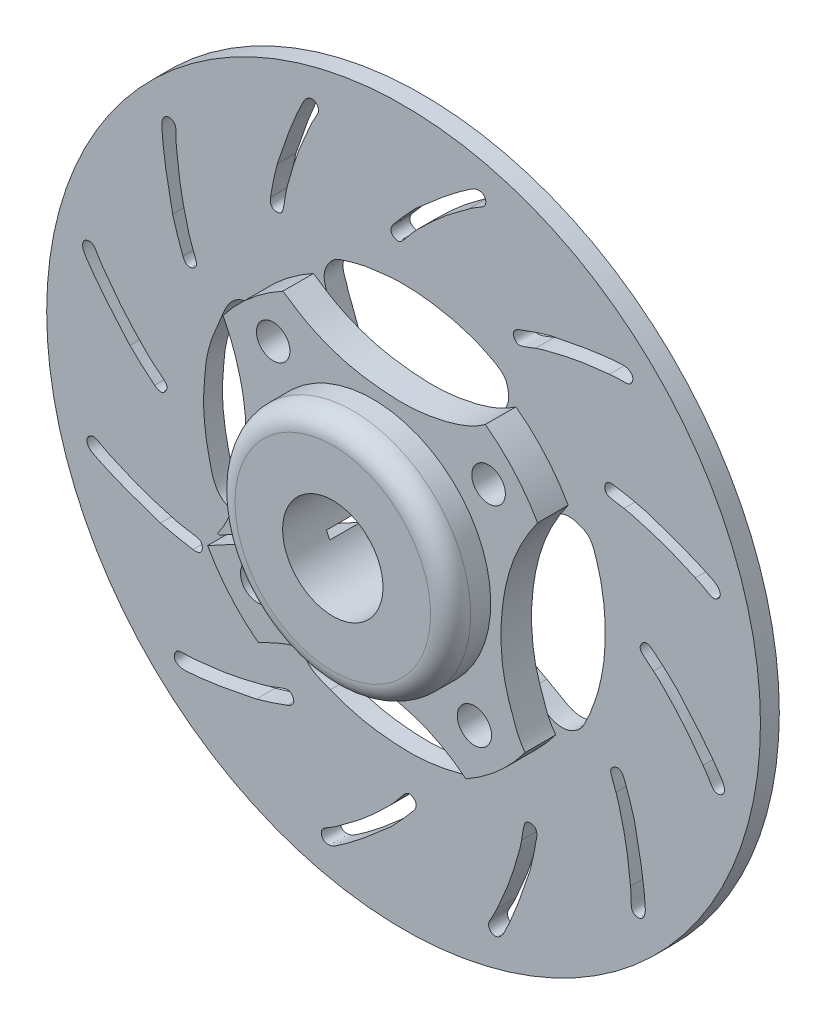
from build123d import *

# Parameters (mm, degrees)
SKETCH1_R             = 88.9
SKETCH1_R_2           = 4.07747742
BOSS_EXTRUDE1_DEPTH   = 4.7
SKETCH2_R             = 4.18367601
SKETCH2_R_2           = 4.175439145
SKETCH2_R_3           = 4.218912194
SKETCH2_R_4           = 4.270344274
BOSS_EXTRUDE2_DEPTH   = 7.62
SKETCH3_R             = 29.35
BOSS_EXTRUDE3_DEPTH   = 10
FILLET1_R             = 5
SKETCH4_R             = 12.5
CUT_EXTRUDE1_DEPTH    = 26
BODY_MOVE_COPY9_ANGLE = 3


with BuildPart() as part:
    # Sketch1 → Boss-Extrude1 (new body)
    with BuildSketch(Plane.XY):
        Circle(SKETCH1_R)
        with Locations((-27.374966014, -24.062451156)):
            Circle(SKETCH1_R_2, mode=Mode.SUBTRACT)
        with Locations((-23.994022432, 28.43754142)):
            Circle(SKETCH1_R_2, mode=Mode.SUBTRACT)
        with Locations((28.505970144, 25.056597838)):
            Circle(SKETCH1_R_2, mode=Mode.SUBTRACT)
        with Locations((25.125026562, -27.443394738)):
            Circle(SKETCH1_R_2, mode=Mode.SUBTRACT)
        with BuildLine():
            add(Edge.make_bspline(
                [(-39.796972275, 26.922044723), (-43.51449301, 25.961041806), (-44.921867219, 21.222131716), (-47.210450222, 16.353689591), (-48.42755617, 12.799512246), (-49.330731017, 9.025790153), (-49.547867266, 4.458947157), (-49.984671254, 0.092855877), (-49.609553632, -4.229262676), (-49.113913448, -8.310445828), (-48.24033715, -12.164679918), (-47.439598583, -15.683903956), (-45.666643473, -18.602778233), (-42.80745232, -19.963202645), (-39.222778152, -19.846001741), (-35.654884057, -18.345655898), (-31.259888958, -16.649549093), (-26.996550931, -15.244238297), (-23.434805875, -13.379026123), (-20.446967539, -13.844570629), (-18.540235541, -15.657785097), (-16.650687923, -17.631197803), (-16.403243332, -20.244855587), (-17.727618064, -22.654996098), (-19.544820805, -25.709175528), (-21.305244064, -29.485905755), (-23.184921482, -32.73263843), (-24.85319827, -35.47153984), (-25.704064387, -38.532729608), (-25.168560148, -41.638766555), (-22.800486373, -44.820200205), (-19.8950043, -45.580827462), (-18.211809321, -46.250491884)],
                knots=[0, 0, 0, 0, 0.086034055, 0.119910947, 0.141356415, 0.183712842, 0.220479367, 0.260324832, 0.297786521, 0.333172123, 0.367414684, 0.400712751, 0.427087621, 0.453178029, 0.478899839, 0.518299636, 0.553136565, 0.601682706, 0.636190375, 0.65438679, 0.676057709, 0.703338417, 0.723663955, 0.739017315, 0.77391887, 0.816795639, 0.847231719, 0.871715557, 0.900233315, 0.928007166, 0.950713121, 1, 1, 1, 1], degree=3))
            add(Edge.make_bspline(
                [(-18.211809321, -46.250491884), (-15.166521025, -47.523075844), (-10.229347315, -48.972216807), (-3.342326696, -49.782278875), (2.061260907, -50.072136286), (7.737154149, -49.615917325), (13.004758266, -48.540454338), (17.329288054, -47.374188933), (19.842696695, -45.445855687), (21.039866084, -43.365599755), (21.493199266, -40.567389743), (20.423007122, -37.83349908), (19.45861076, -34.902866543), (18.14762822, -31.801616538), (17.129292363, -28.607313593), (16.003433633, -25.802064999), (14.939213578, -23.719432358), (14.743311284, -21.291754206), (16.255989207, -18.952313297), (18.263003746, -17.271408565), (20.68643576, -16.30365833), (22.78775311, -17.146615398), (24.688263657, -18.388911752), (27.535060335, -19.84486722), (29.626565694, -21.026295959), (30.974445426, -21.751193564)],
                knots=[0, 0, 0, 0, 0.11787223, 0.182265264, 0.247283311, 0.310808064, 0.384701481, 0.439833927, 0.468325465, 0.495251715, 0.523732965, 0.566276116, 0.597265592, 0.634461316, 0.686170615, 0.716946378, 0.74224478, 0.769577195, 0.799045484, 0.837192377, 0.86349158, 0.886332937, 0.914024889, 0.945422786, 1, 1, 1, 1], degree=3))
            add(Edge.make_bspline(
                [(30.974445426, -21.751193564), (32.003322346, -22.374489021), (33.934722137, -23.332169814), (36.304190872, -24.868561945), (38.493781279, -25.582660313), (40.651674723, -25.61071046), (42.684454755, -24.737671182), (44.336475558, -23.374838722), (45.288106968, -21.560274073), (46.306314995, -19.51151721), (47.282433933, -16.799965604), (48.452928233, -13.585106381), (49.377849207, -9.568991543), (49.970870195, -6.026848976), (50.203591073, -2.376298778), (50.262637511, 0.517619958), (50.17235244, 3.466086556), (49.977695835, 5.836180957), (49.563199559, 8.633723766), (49.012593166, 11.765977263), (48.058919569, 14.912858134), (47.225800856, 17.519289802), (45.876010276, 19.520434025), (44.368387326, 20.003608014), (43.540911194, 20.363194028), (43.170642612, 20.469865616), (42.683521538, 20.645792677), (42.237368456, 20.72883244), (41.588584465, 20.783006234), (40.607897889, 20.851741113), (39.485156628, 20.494729116), (37.975205491, 19.946335778), (34.96346939, 18.779417356), (32.30237294, 17.877509803), (30.343888009, 17.164066957)],
                knots=[0, 0, 0, 0, 0.047660097, 0.085570693, 0.111479653, 0.13806014, 0.169229235, 0.197306097, 0.221160681, 0.249655524, 0.288252435, 0.33527207, 0.385315565, 0.451498919, 0.477486394, 0.530381896, 0.56627772, 0.594482099, 0.624670246, 0.678458715, 0.720529439, 0.754689328, 0.787884057, 0.810482048, 0.815240602, 0.82390699, 0.827813968, 0.833221312, 0.842621175, 0.853312213, 0.87205883, 0.888423793, 0.917333374, 1, 1, 1, 1], degree=3))
            add(Edge.make_bspline(
                [(30.343888009, 17.164066957), (29.309153231, 16.769671968), (27.823788742, 16.031805009), (25.692033419, 15.351599736), (24.026422046, 14.576924915), (22.056536511, 14.680432714), (20.347787272, 15.758849313), (19.25671454, 17.289264458), (17.800238421, 18.40619954), (17.546423648, 19.996255141), (17.382935291, 21.496194833), (18.19632835, 22.992919838), (19.48743127, 25.199625743), (21.081573968, 28.319857376), (23.1358263, 31.941108367), (24.631619477, 34.786294903), (25.639757271, 36.667447605), (26.070458694, 37.856679179), (26.23407121, 38.967242597), (26.076816537, 40.296517815), (25.851000604, 41.674502908), (25.097495446, 43.038039825), (24.381833125, 43.653138353), (23.995841352, 43.931022196)],
                knots=[0, 0, 0, 0, 0.078169858, 0.116383522, 0.157902413, 0.206456957, 0.247952262, 0.295693498, 0.339561834, 0.369996849, 0.405552268, 0.443740642, 0.485880857, 0.587567207, 0.689814094, 0.779788252, 0.814358994, 0.840151294, 0.868713812, 0.892473634, 0.934347025, 0.966355314, 1, 1, 1, 1], degree=3))
            add(Edge.make_bspline(
                [(23.995841352, 43.931022196), (23.659598549, 44.22140694), (22.94750498, 44.694684198), (21.95653751, 45.153189095), (21.072047035, 45.655193214), (20.086146911, 46.087666907), (18.562842117, 46.836899702), (17.329899632, 47.337613246), (16.500112708, 47.585529311)],
                knots=[0, 0, 0, 0, 0.15927464, 0.304479599, 0.39124603, 0.523648309, 0.690107311, 1, 1, 1, 1], degree=3))
            add(Edge.make_bspline(
                [(16.500112708, 47.585529311), (15.62871215, 47.82182276), (14.144310198, 48.312562047), (12.00593847, 48.914921007), (10.124650846, 49.22827568), (7.216668416, 49.833129199), (2.875733188, 50.316651449), (-2.068807492, 50.428004213), (-6.562993204, 49.813803523), (-10.405562033, 49.396042331), (-13.830701738, 48.3296996), (-16.662729213, 47.574325783), (-18.170444851, 46.204887964), (-19.040736095, 44.917914669), (-19.698551589, 43.496488316), (-19.838012478, 41.980280907), (-19.596021289, 40.420342012), (-19.04388369, 39.229690859), (-18.738482473, 38.181442938), (-18.51906425, 37.181736497), (-17.98677624, 35.992926871), (-17.377491853, 34.476256259), (-16.703228307, 32.453551802), (-15.762528666, 30.252671875), (-14.950427911, 27.937138544), (-14.34281483, 26.228871699), (-13.788324327, 24.999593485), (-13.433839666, 23.709261101), (-13.509100351, 21.984502518), (-14.601602107, 20.476008479), (-16.000159559, 19.379670129), (-17.276283985, 18.267341087), (-18.922392447, 17.60789758), (-20.627709795, 17.733190246), (-21.879139023, 18.533749656), (-23.070839635, 18.996403453), (-23.964005569, 19.640759431), (-25.061086064, 20.110092987), (-26.118522029, 20.783972816), (-27.600092577, 21.542501478), (-29.823023598, 22.759273556), (-32.11643212, 24.093283711), (-34.185756925, 25.292491799), (-35.454366164, 26.062464637), (-36.58038147, 26.400412602), (-38.001595931, 26.792882768), (-39.025127264, 27.018228963), (-39.796972275, 26.922044723)],
                knots=[0, 0, 0, 0, 0.02963422, 0.051354753, 0.07284978, 0.09221066, 0.148871737, 0.216074291, 0.253828779, 0.297826147, 0.342407935, 0.372050129, 0.39221048, 0.407591461, 0.423002468, 0.443122136, 0.45651194, 0.474439519, 0.485893825, 0.492331806, 0.507994362, 0.52843352, 0.546065225, 0.577953483, 0.606967471, 0.626633827, 0.63746718, 0.651191656, 0.670392634, 0.691793228, 0.709703481, 0.729000297, 0.747008178, 0.766568579, 0.782311539, 0.795237618, 0.808382798, 0.818183391, 0.834297561, 0.849454636, 0.872826412, 0.917516751, 0.936517589, 0.951474041, 0.966000407, 0.974861338, 1, 1, 1, 1], degree=3))
        make_face(mode=Mode.SUBTRACT)
        with BuildLine():
            add(Edge.make_bspline(
                [(-31.472558231, 60.540603915), (-29.764581382, 65.34489088), (-28.513412004, 69.651124006), (-25.720195066, 75.626600274), (-25.007339846, 77.20002944), (-24.186931765, 78.430801548), (-22.745075318, 79.116705574), (-21.526689329, 78.435047494), (-20.980866309, 77.196730149), (-21.970728074, 75.223848717), (-22.82200754, 73.889425632), (-23.312380942, 72.67385443)],
                knots=[0, 0, 0, 0, 0.504601115, 0.560680655, 0.631374965, 0.687572346, 0.734694365, 0.781164138, 0.819557005, 0.866509133, 1, 1, 1, 1], degree=3))
            add(Edge.make_bspline(
                [(-23.312380942, 72.67385443), (-23.656709462, 71.683995658), (-24.439890031, 70.241305942), (-25.336678529, 67.848036288), (-26.245677579, 65.927605792), (-26.783341534, 63.821859344), (-27.479255907, 62.240447779), (-27.999798512, 60.49633404), (-28.595297781, 58.10072981), (-29.231668661, 56.208056413), (-29.410721478, 54.925352246)],
                knots=[0, 0, 0, 0, 0.166737046, 0.260765648, 0.407477512, 0.504417848, 0.606220534, 0.68233795, 0.794384205, 1, 1, 1, 1], degree=3))
            add(Edge.make_bspline(
                [(-29.410721478, 54.925352246), (-29.586422582, 54.020509087), (-29.69256378, 52.813701689), (-30.030392713, 51.338764458), (-30.384212935, 50.295087668), (-31.654508753, 50.027037686), (-33.222959963, 50.481263538), (-33.242485552, 51.890552827), (-33.151947829, 52.476040032)],
                knots=[0, 0, 0, 0, 0.309574359, 0.393483277, 0.512236199, 0.643022767, 0.780582146, 1, 1, 1, 1], degree=3))
            add(Edge.make_bspline(
                [(-31.472558231, 60.540603915), (-31.855191575, 59.138802545), (-32.445651368, 56.455204136), (-32.942095765, 53.753351228), (-33.151947829, 52.476040032)],
                knots=[0, 0, 0, 0, 0.528781881, 1, 1, 1, 1], degree=3))
        make_face(mode=Mode.SUBTRACT)
        with BuildLine():
            add(Edge.make_bspline(
                [(16.147813097, 74.593594598), (15.354686465, 73.908516015), (13.955087339, 73.050700356), (11.98181089, 71.426462287), (10.234379373, 70.217820216), (8.715875505, 68.663022276), (7.322490197, 67.641436873), (5.999630208, 66.391261371), (4.286110598, 64.614356884), (2.788660551, 63.293439082), (1.992244179, 62.272111096)],
                knots=[0, 0, 0, 0, 0.166737046, 0.260765648, 0.407477512, 0.504417848, 0.606220534, 0.68233795, 0.794384205, 1, 1, 1, 1], degree=3))
            add(Edge.make_bspline(
                [(1.992244179, 62.272111096), (1.38766098, 61.576344486), (0.692336307, 60.584289221), (-0.337700746, 59.475870577), (-1.165956442, 58.748930074), (-2.400089881, 59.151939889), (-3.531295548, 60.32953662), (-2.843560559, 61.559779741), (-2.472408989, 62.021557672)],
                knots=[0, 0, 0, 0, 0.309574359, 0.393483277, 0.512236199, 0.643022767, 0.780582146, 1, 1, 1, 1], degree=3))
            add(Edge.make_bspline(
                [(3.014267007, 68.165980066), (1.981996126, 67.14330114), (0.128843741, 65.114466641), (-1.652016173, 63.022815584), (-2.472408989, 62.021557672)],
                knots=[0, 0, 0, 0, 0.528781881, 1, 1, 1, 1], degree=3))
            add(Edge.make_bspline(
                [(3.014267007, 68.165980066), (6.895561831, 71.472626201), (10.132222859, 74.576348793), (15.53895782, 78.354654572), (16.943023133, 79.360856591), (18.268903426, 80.016532463), (19.860539751, 79.88961455), (20.574863929, 78.690088342), (20.428401857, 77.344762553), (18.584715707, 76.131127996), (17.180274521, 75.401123439), (16.147813097, 74.593594598)],
                knots=[0, 0, 0, 0, 0.504601115, 0.560680655, 0.631374965, 0.687572346, 0.734694365, 0.781164138, 0.819557005, 0.866509133, 1, 1, 1, 1], degree=3))
        make_face(mode=Mode.SUBTRACT)
        with BuildLine():
            add(Edge.make_bspline(
                [(51.281213657, 56.526041333), (50.251806554, 56.329309193), (48.610810326, 56.286218603), (46.089783757, 55.866225398), (43.972142637, 55.693226419), (41.879680742, 55.105983839), (40.162180966, 54.917957582), (38.391462859, 54.496703832), (36.019059103, 53.814619212), (34.061770421, 53.419395862), (32.861389618, 52.933108067)],
                knots=[0, 0, 0, 0, 0.166737046, 0.260765648, 0.407477512, 0.504417848, 0.606220534, 0.68233795, 0.794384205, 1, 1, 1, 1], degree=3))
            add(Edge.make_bspline(
                [(32.861389618, 52.933108067), (31.989921904, 52.632848107), (30.891725441, 52.121365382), (29.445477863, 51.676465205), (28.364717139, 51.46104411), (27.497431136, 52.427127567), (27.106576658, 54.012559086), (28.317294189, 54.734113386), (28.869609843, 54.948449021)],
                knots=[0, 0, 0, 0, 0.309574359, 0.393483277, 0.512236199, 0.643022767, 0.780582146, 1, 1, 1, 1], degree=3))
            add(Edge.make_bspline(
                [(36.693421835, 57.526336908), (35.288109566, 57.156806418), (32.668815273, 56.326360395), (30.080719819, 55.405367401), (28.869609843, 54.948449021)],
                knots=[0, 0, 0, 0, 0.528781881, 1, 1, 1, 1], degree=3))
            add(Edge.make_bspline(
                [(36.693421835, 57.526336908), (41.708044819, 58.44932905), (46.062936789, 59.518901147), (52.634459506, 60.087642454), (54.353516745, 60.257006307), (55.829600697, 60.161898123), (57.144539232, 59.256165823), (57.163399013, 57.860183565), (56.363896244, 56.768328292), (54.160399922, 56.63913301), (52.579115899, 56.709151111), (51.281213657, 56.526041333)],
                knots=[0, 0, 0, 0, 0.504601115, 0.560680655, 0.631374965, 0.687572346, 0.734694365, 0.781164138, 0.819557005, 0.866509133, 1, 1, 1, 1], degree=3))
        make_face(mode=Mode.SUBTRACT)
        with BuildLine():
            add(Edge.make_bspline(
                [(72.67385443, 23.312380942), (71.683995658, 23.656709462), (70.241305942, 24.439890031), (67.848036288, 25.336678529), (65.927605792, 26.245677579), (63.821859344, 26.783341534), (62.240447779, 27.479255907), (60.49633404, 27.999798512), (58.10072981, 28.595297781), (56.208056413, 29.231668661), (54.925352246, 29.410721478)],
                knots=[0, 0, 0, 0, 0.166737046, 0.260765648, 0.407477512, 0.504417848, 0.606220534, 0.68233795, 0.794384205, 1, 1, 1, 1], degree=3))
            add(Edge.make_bspline(
                [(54.925352246, 29.410721478), (54.020509087, 29.586422582), (52.813701689, 29.69256378), (51.338764458, 30.030392713), (50.295087668, 30.384212935), (50.027037686, 31.654508753), (50.481263538, 33.222959963), (51.890552827, 33.242485552), (52.476040032, 33.151947829)],
                knots=[0, 0, 0, 0, 0.309574359, 0.393483277, 0.512236199, 0.643022767, 0.780582146, 1, 1, 1, 1], degree=3))
            add(Edge.make_bspline(
                [(60.540603915, 31.472558231), (59.138802545, 31.855191575), (56.455204136, 32.445651368), (53.753351228, 32.942095765), (52.476040032, 33.151947829)],
                knots=[0, 0, 0, 0, 0.528781881, 1, 1, 1, 1], degree=3))
            add(Edge.make_bspline(
                [(60.540603915, 31.472558231), (65.34489088, 29.764581382), (69.651124006, 28.513412004), (75.626600274, 25.720195066), (77.20002944, 25.007339846), (78.430801548, 24.186931765), (79.116705574, 22.745075318), (78.435047494, 21.526689329), (77.196730149, 20.980866309), (75.223848717, 21.970728074), (73.889425632, 22.82200754), (72.67385443, 23.312380942)],
                knots=[0, 0, 0, 0, 0.504601115, 0.560680655, 0.631374965, 0.687572346, 0.734694365, 0.781164138, 0.819557005, 0.866509133, 1, 1, 1, 1], degree=3))
        make_face(mode=Mode.SUBTRACT)
        with BuildLine():
            add(Edge.make_bspline(
                [(74.593594598, -16.147813097), (73.908516015, -15.354686465), (73.050700356, -13.955087339), (71.426462287, -11.98181089), (70.217820216, -10.234379373), (68.663022276, -8.715875505), (67.641436873, -7.322490197), (66.391261371, -5.999630208), (64.614356884, -4.286110598), (63.293439082, -2.788660551), (62.272111096, -1.992244179)],
                knots=[0, 0, 0, 0, 0.166737046, 0.260765648, 0.407477512, 0.504417848, 0.606220534, 0.68233795, 0.794384205, 1, 1, 1, 1], degree=3))
            add(Edge.make_bspline(
                [(62.272111096, -1.992244179), (61.576344486, -1.38766098), (60.584289221, -0.692336307), (59.475870577, 0.337700746), (58.748930074, 1.165956442), (59.151939889, 2.400089881), (60.32953662, 3.531295548), (61.559779741, 2.843560559), (62.021557672, 2.472408989)],
                knots=[0, 0, 0, 0, 0.309574359, 0.393483277, 0.512236199, 0.643022767, 0.780582146, 1, 1, 1, 1], degree=3))
            add(Edge.make_bspline(
                [(68.165980066, -3.014267007), (67.14330114, -1.981996126), (65.114466641, -0.128843741), (63.022815584, 1.652016173), (62.021557672, 2.472408989)],
                knots=[0, 0, 0, 0, 0.528781881, 1, 1, 1, 1], degree=3))
            add(Edge.make_bspline(
                [(68.165980066, -3.014267007), (71.472626201, -6.895561831), (74.576348793, -10.132222859), (78.354654572, -15.53895782), (79.360856591, -16.943023133), (80.016532463, -18.268903426), (79.88961455, -19.860539751), (78.690088342, -20.574863929), (77.344762553, -20.428401857), (76.131127996, -18.584715707), (75.401123439, -17.180274521), (74.593594598, -16.147813097)],
                knots=[0, 0, 0, 0, 0.504601115, 0.560680655, 0.631374965, 0.687572346, 0.734694365, 0.781164138, 0.819557005, 0.866509133, 1, 1, 1, 1], degree=3))
        make_face(mode=Mode.SUBTRACT)
        with BuildLine():
            add(Edge.make_bspline(
                [(56.526041333, -51.281213657), (56.329309193, -50.251806554), (56.286218603, -48.610810326), (55.866225398, -46.089783757), (55.693226419, -43.972142637), (55.105983839, -41.879680742), (54.917957582, -40.162180966), (54.496703832, -38.391462859), (53.814619212, -36.019059103), (53.419395862, -34.061770421), (52.933108067, -32.861389618)],
                knots=[0, 0, 0, 0, 0.166737046, 0.260765648, 0.407477512, 0.504417848, 0.606220534, 0.68233795, 0.794384205, 1, 1, 1, 1], degree=3))
            add(Edge.make_bspline(
                [(52.933108067, -32.861389618), (52.632848107, -31.989921904), (52.121365382, -30.891725441), (51.676465205, -29.445477863), (51.46104411, -28.364717139), (52.427127567, -27.497431136), (54.012559086, -27.106576658), (54.734113386, -28.317294189), (54.948449021, -28.869609843)],
                knots=[0, 0, 0, 0, 0.309574359, 0.393483277, 0.512236199, 0.643022767, 0.780582146, 1, 1, 1, 1], degree=3))
            add(Edge.make_bspline(
                [(57.526336908, -36.693421835), (57.156806418, -35.288109566), (56.326360395, -32.668815273), (55.405367401, -30.080719819), (54.948449021, -28.869609843)],
                knots=[0, 0, 0, 0, 0.528781881, 1, 1, 1, 1], degree=3))
            add(Edge.make_bspline(
                [(57.526336908, -36.693421835), (58.44932905, -41.708044819), (59.518901147, -46.062936789), (60.087642454, -52.634459506), (60.257006307, -54.353516745), (60.161898123, -55.829600697), (59.256165823, -57.144539232), (57.860183565, -57.163399013), (56.768328292, -56.363896244), (56.63913301, -54.160399922), (56.709151111, -52.579115899), (56.526041333, -51.281213657)],
                knots=[0, 0, 0, 0, 0.504601115, 0.560680655, 0.631374965, 0.687572346, 0.734694365, 0.781164138, 0.819557005, 0.866509133, 1, 1, 1, 1], degree=3))
        make_face(mode=Mode.SUBTRACT)
        with BuildLine():
            add(Edge.make_bspline(
                [(23.312380942, -72.67385443), (23.656709462, -71.683995658), (24.439890031, -70.241305942), (25.336678529, -67.848036288), (26.245677579, -65.927605792), (26.783341534, -63.821859344), (27.479255907, -62.240447779), (27.999798512, -60.49633404), (28.595297781, -58.10072981), (29.231668661, -56.208056413), (29.410721478, -54.925352246)],
                knots=[0, 0, 0, 0, 0.166737046, 0.260765648, 0.407477512, 0.504417848, 0.606220534, 0.68233795, 0.794384205, 1, 1, 1, 1], degree=3))
            add(Edge.make_bspline(
                [(29.410721478, -54.925352246), (29.586422582, -54.020509087), (29.69256378, -52.813701689), (30.030392713, -51.338764458), (30.384212935, -50.295087668), (31.654508753, -50.027037686), (33.222959963, -50.481263538), (33.242485552, -51.890552827), (33.151947829, -52.476040032)],
                knots=[0, 0, 0, 0, 0.309574359, 0.393483277, 0.512236199, 0.643022767, 0.780582146, 1, 1, 1, 1], degree=3))
            add(Edge.make_bspline(
                [(31.472558231, -60.540603915), (31.855191575, -59.138802545), (32.445651368, -56.455204136), (32.942095765, -53.753351228), (33.151947829, -52.476040032)],
                knots=[0, 0, 0, 0, 0.528781881, 1, 1, 1, 1], degree=3))
            add(Edge.make_bspline(
                [(31.472558231, -60.540603915), (29.764581382, -65.34489088), (28.513412004, -69.651124006), (25.720195066, -75.626600274), (25.007339846, -77.20002944), (24.186931765, -78.430801548), (22.745075318, -79.116705574), (21.526689329, -78.435047494), (20.980866309, -77.196730149), (21.970728074, -75.223848717), (22.82200754, -73.889425632), (23.312380942, -72.67385443)],
                knots=[0, 0, 0, 0, 0.504601115, 0.560680655, 0.631374965, 0.687572346, 0.734694365, 0.781164138, 0.819557005, 0.866509133, 1, 1, 1, 1], degree=3))
        make_face(mode=Mode.SUBTRACT)
        with BuildLine():
            add(Edge.make_bspline(
                [(-16.147813097, -74.593594598), (-15.354686465, -73.908516015), (-13.955087339, -73.050700356), (-11.98181089, -71.426462287), (-10.234379373, -70.217820216), (-8.715875505, -68.663022276), (-7.322490197, -67.641436873), (-5.999630208, -66.391261371), (-4.286110598, -64.614356884), (-2.788660551, -63.293439082), (-1.992244179, -62.272111096)],
                knots=[0, 0, 0, 0, 0.166737046, 0.260765648, 0.407477512, 0.504417848, 0.606220534, 0.68233795, 0.794384205, 1, 1, 1, 1], degree=3))
            add(Edge.make_bspline(
                [(-1.992244179, -62.272111096), (-1.38766098, -61.576344486), (-0.692336307, -60.584289221), (0.337700746, -59.475870577), (1.165956442, -58.748930074), (2.400089881, -59.151939889), (3.531295548, -60.32953662), (2.843560559, -61.559779741), (2.472408989, -62.021557672)],
                knots=[0, 0, 0, 0, 0.309574359, 0.393483277, 0.512236199, 0.643022767, 0.780582146, 1, 1, 1, 1], degree=3))
            add(Edge.make_bspline(
                [(-3.014267007, -68.165980066), (-1.981996126, -67.14330114), (-0.128843741, -65.114466641), (1.652016173, -63.022815584), (2.472408989, -62.021557672)],
                knots=[0, 0, 0, 0, 0.528781881, 1, 1, 1, 1], degree=3))
            add(Edge.make_bspline(
                [(-3.014267007, -68.165980066), (-6.895561831, -71.472626201), (-10.132222859, -74.576348793), (-15.53895782, -78.354654572), (-16.943023133, -79.360856591), (-18.268903426, -80.016532463), (-19.860539751, -79.88961455), (-20.574863929, -78.690088342), (-20.428401857, -77.344762553), (-18.584715707, -76.131127996), (-17.180274521, -75.401123439), (-16.147813097, -74.593594598)],
                knots=[0, 0, 0, 0, 0.504601115, 0.560680655, 0.631374965, 0.687572346, 0.734694365, 0.781164138, 0.819557005, 0.866509133, 1, 1, 1, 1], degree=3))
        make_face(mode=Mode.SUBTRACT)
        with BuildLine():
            add(Edge.make_bspline(
                [(-51.281213657, -56.526041333), (-50.251806554, -56.329309193), (-48.610810326, -56.286218603), (-46.089783757, -55.866225398), (-43.972142637, -55.693226419), (-41.879680742, -55.105983839), (-40.162180966, -54.917957582), (-38.391462859, -54.496703832), (-36.019059103, -53.814619212), (-34.061770421, -53.419395862), (-32.861389618, -52.933108067)],
                knots=[0, 0, 0, 0, 0.166737046, 0.260765648, 0.407477512, 0.504417848, 0.606220534, 0.68233795, 0.794384205, 1, 1, 1, 1], degree=3))
            add(Edge.make_bspline(
                [(-32.861389618, -52.933108067), (-31.989921904, -52.632848107), (-30.891725441, -52.121365382), (-29.445477863, -51.676465205), (-28.364717139, -51.46104411), (-27.497431136, -52.427127567), (-27.106576658, -54.012559086), (-28.317294189, -54.734113386), (-28.869609843, -54.948449021)],
                knots=[0, 0, 0, 0, 0.309574359, 0.393483277, 0.512236199, 0.643022767, 0.780582146, 1, 1, 1, 1], degree=3))
            add(Edge.make_bspline(
                [(-36.693421835, -57.526336908), (-35.288109566, -57.156806418), (-32.668815273, -56.326360395), (-30.080719819, -55.405367401), (-28.869609843, -54.948449021)],
                knots=[0, 0, 0, 0, 0.528781881, 1, 1, 1, 1], degree=3))
            add(Edge.make_bspline(
                [(-36.693421835, -57.526336908), (-41.708044819, -58.44932905), (-46.062936789, -59.518901147), (-52.634459506, -60.087642454), (-54.353516745, -60.257006307), (-55.829600697, -60.161898123), (-57.144539232, -59.256165823), (-57.163399013, -57.860183565), (-56.363896244, -56.768328292), (-54.160399922, -56.63913301), (-52.579115899, -56.709151111), (-51.281213657, -56.526041333)],
                knots=[0, 0, 0, 0, 0.504601115, 0.560680655, 0.631374965, 0.687572346, 0.734694365, 0.781164138, 0.819557005, 0.866509133, 1, 1, 1, 1], degree=3))
        make_face(mode=Mode.SUBTRACT)
        with BuildLine():
            add(Edge.make_bspline(
                [(-72.67385443, -23.312380942), (-71.683995658, -23.656709462), (-70.241305942, -24.439890031), (-67.848036288, -25.336678529), (-65.927605792, -26.245677579), (-63.821859344, -26.783341534), (-62.240447779, -27.479255907), (-60.49633404, -27.999798512), (-58.10072981, -28.595297781), (-56.208056413, -29.231668661), (-54.925352246, -29.410721478)],
                knots=[0, 0, 0, 0, 0.166737046, 0.260765648, 0.407477512, 0.504417848, 0.606220534, 0.68233795, 0.794384205, 1, 1, 1, 1], degree=3))
            add(Edge.make_bspline(
                [(-54.925352246, -29.410721478), (-54.020509087, -29.586422582), (-52.813701689, -29.69256378), (-51.338764458, -30.030392713), (-50.295087668, -30.384212935), (-50.027037686, -31.654508753), (-50.481263538, -33.222959963), (-51.890552827, -33.242485552), (-52.476040032, -33.151947829)],
                knots=[0, 0, 0, 0, 0.309574359, 0.393483277, 0.512236199, 0.643022767, 0.780582146, 1, 1, 1, 1], degree=3))
            add(Edge.make_bspline(
                [(-60.540603915, -31.472558231), (-59.138802545, -31.855191575), (-56.455204136, -32.445651368), (-53.753351228, -32.942095765), (-52.476040032, -33.151947829)],
                knots=[0, 0, 0, 0, 0.528781881, 1, 1, 1, 1], degree=3))
            add(Edge.make_bspline(
                [(-60.540603915, -31.472558231), (-65.34489088, -29.764581382), (-69.651124006, -28.513412004), (-75.626600274, -25.720195066), (-77.20002944, -25.007339846), (-78.430801548, -24.186931765), (-79.116705574, -22.745075318), (-78.435047494, -21.526689329), (-77.196730149, -20.980866309), (-75.223848717, -21.970728074), (-73.889425632, -22.82200754), (-72.67385443, -23.312380942)],
                knots=[0, 0, 0, 0, 0.504601115, 0.560680655, 0.631374965, 0.687572346, 0.734694365, 0.781164138, 0.819557005, 0.866509133, 1, 1, 1, 1], degree=3))
        make_face(mode=Mode.SUBTRACT)
        with BuildLine():
            add(Edge.make_bspline(
                [(-74.593594598, 16.147813097), (-73.908516015, 15.354686465), (-73.050700356, 13.955087339), (-71.426462287, 11.98181089), (-70.217820216, 10.234379373), (-68.663022276, 8.715875505), (-67.641436873, 7.322490197), (-66.391261371, 5.999630208), (-64.614356884, 4.286110598), (-63.293439082, 2.788660551), (-62.272111096, 1.992244179)],
                knots=[0, 0, 0, 0, 0.166737046, 0.260765648, 0.407477512, 0.504417848, 0.606220534, 0.68233795, 0.794384205, 1, 1, 1, 1], degree=3))
            add(Edge.make_bspline(
                [(-62.272111096, 1.992244179), (-61.576344486, 1.38766098), (-60.584289221, 0.692336307), (-59.475870577, -0.337700746), (-58.748930074, -1.165956442), (-59.151939889, -2.400089881), (-60.32953662, -3.531295548), (-61.559779741, -2.843560559), (-62.021557672, -2.472408989)],
                knots=[0, 0, 0, 0, 0.309574359, 0.393483277, 0.512236199, 0.643022767, 0.780582146, 1, 1, 1, 1], degree=3))
            add(Edge.make_bspline(
                [(-68.165980066, 3.014267007), (-67.14330114, 1.981996126), (-65.114466641, 0.128843741), (-63.022815584, -1.652016173), (-62.021557672, -2.472408989)],
                knots=[0, 0, 0, 0, 0.528781881, 1, 1, 1, 1], degree=3))
            add(Edge.make_bspline(
                [(-68.165980066, 3.014267007), (-71.472626201, 6.895561831), (-74.576348793, 10.132222859), (-78.354654572, 15.53895782), (-79.360856591, 16.943023133), (-80.016532463, 18.268903426), (-79.88961455, 19.860539751), (-78.690088342, 20.574863929), (-77.344762553, 20.428401857), (-76.131127996, 18.584715707), (-75.401123439, 17.180274521), (-74.593594598, 16.147813097)],
                knots=[0, 0, 0, 0, 0.504601115, 0.560680655, 0.631374965, 0.687572346, 0.734694365, 0.781164138, 0.819557005, 0.866509133, 1, 1, 1, 1], degree=3))
        make_face(mode=Mode.SUBTRACT)
        with BuildLine():
            add(Edge.make_bspline(
                [(-56.526041333, 51.281213657), (-56.329309193, 50.251806554), (-56.286218603, 48.610810326), (-55.866225398, 46.089783757), (-55.693226419, 43.972142637), (-55.105983839, 41.879680742), (-54.917957582, 40.162180966), (-54.496703832, 38.391462859), (-53.814619212, 36.019059103), (-53.419395862, 34.061770421), (-52.933108067, 32.861389618)],
                knots=[0, 0, 0, 0, 0.166737046, 0.260765648, 0.407477512, 0.504417848, 0.606220534, 0.68233795, 0.794384205, 1, 1, 1, 1], degree=3))
            add(Edge.make_bspline(
                [(-52.933108067, 32.861389618), (-52.632848107, 31.989921904), (-52.121365382, 30.891725441), (-51.676465205, 29.445477863), (-51.46104411, 28.364717139), (-52.427127567, 27.497431136), (-54.012559086, 27.106576658), (-54.734113386, 28.317294189), (-54.948449021, 28.869609843)],
                knots=[0, 0, 0, 0, 0.309574359, 0.393483277, 0.512236199, 0.643022767, 0.780582146, 1, 1, 1, 1], degree=3))
            add(Edge.make_bspline(
                [(-57.526336908, 36.693421835), (-57.156806418, 35.288109566), (-56.326360395, 32.668815273), (-55.405367401, 30.080719819), (-54.948449021, 28.869609843)],
                knots=[0, 0, 0, 0, 0.528781881, 1, 1, 1, 1], degree=3))
            add(Edge.make_bspline(
                [(-57.526336908, 36.693421835), (-58.44932905, 41.708044819), (-59.518901147, 46.062936789), (-60.087642454, 52.634459506), (-60.257006307, 54.353516745), (-60.161898123, 55.829600697), (-59.256165823, 57.144539232), (-57.860183565, 57.163399013), (-56.768328292, 56.363896244), (-56.63913301, 54.160399922), (-56.709151111, 52.579115899), (-56.526041333, 51.281213657)],
                knots=[0, 0, 0, 0, 0.504601115, 0.560680655, 0.631374965, 0.687572346, 0.734694365, 0.781164138, 0.819557005, 0.866509133, 1, 1, 1, 1], degree=3))
        make_face(mode=Mode.SUBTRACT)
    extrude(amount=BOSS_EXTRUDE1_DEPTH)


with BuildPart() as body_2:
    # Sketch2 → Boss-Extrude2 (new body)
    with BuildSketch(Plane.XY):
        with BuildLine():
            Line((-37.634628687, -20.912344774), (-37.291812926, -21.144121861))
            Line((-37.291812926, -21.144121861), (-11.223016332, -5.265934491))
            Line((-11.223016332, -5.265934491), (-10.23664952, -6.885350813))
            Line((-10.23664952, -6.885350813), (-39.934023895, -24.973660835))
            ThreePointArc((-39.934023895, -24.973660835), (-33.984841042, -32.610436663), (-26.600023864, -38.869637642))
            add(Edge.make_bspline(
                [(-26.600023864, -38.869637642), (-24.761438401, -37.97211903), (-21.903510209, -36.208164043), (-17.21787538, -34.378439177), (-13.589667595, -33.09070669), (-10.585363184, -32.673119773), (-8.180711141, -32.04475275), (-5.609039967, -31.712900838), (6.251058427, -31.326360641), (17.100214733, -33.654973829), (25.269988061, -39.747172269)],
                knots=[0, 0, 0, 0, 0.112337385, 0.183127321, 0.275731791, 0.322385942, 0.349032382, 0.411967602, 0.463999396, 1, 1, 1, 1], degree=3))
            ThreePointArc((25.269988061, -39.747172269), (33.029651651, -33.57755369), (39.326086643, -25.920434204))
            add(Edge.make_bspline(
                [(39.326086643, -25.920434204), (37.492152301, -23.839115667), (35.887941168, -19.759926366), (33.313069016, -13.188082951), (31.873499446, -4.862277637), (32.039688537, 4.750971469), (34.398988348, 15.519723977), (37.503789987, 21.776801269), (39.749145928, 25.266883425)],
                knots=[0, 0, 0, 0, 0.152149228, 0.240137859, 0.391778365, 0.616919879, 0.769442046, 1, 1, 1, 1], degree=3))
            ThreePointArc((39.749145928, 25.266883425), (33.607458625, 32.999223093), (25.988567778, 39.281093987))
            add(Edge.make_bspline(
                [(-24.562828341, 40.188026375), (-22.966170353, 39.317401288), (-20.164475182, 37.493432085), (-15.784957454, 35.562085879), (-11.578567665, 34.185840708), (-6.356884184, 32.968294073), (-0.437103173, 32.496867952), (6.292737014, 32.381156794), (12.255712087, 33.297732955), (19.111443694, 35.2071507), (23.562649974, 37.284104005), (25.988567778, 39.281093987)],
                knots=[0, 0, 0, 0, 0.102146543, 0.187239333, 0.267910646, 0.350500983, 0.487691025, 0.600458122, 0.72789444, 0.824624761, 1, 1, 1, 1], degree=3))
            ThreePointArc((-24.562828341, 40.188026375), (-32.390112868, 34.194891262), (-38.798452115, 26.70374718))
            add(Edge.make_bspline(
                [(-38.798452115, 26.70374718), (-37.95067403, 25.277134515), (-36.64278513, 22.908870562), (-35.149197952, 19.312999787), (-33.931300109, 15.746504912), (-32.93267278, 12.218235445), (-32.313647677, 8.693313011), (-31.716772402, 4.098576738), (-31.634912302, -1.098550362), (-32.507160219, -6.520393309), (-33.94323864, -12.894759656), (-35.577505346, -17.869704486), (-37.634628687, -20.912344774)],
                knots=[0, 0, 0, 0, 0.099929725, 0.162468275, 0.234078025, 0.326708138, 0.382759029, 0.44929479, 0.605596003, 0.69319576, 0.779016413, 1, 1, 1, 1], degree=3))
        make_face()
        with Locations((27.436514079, 26.829222529)):
            Circle(SKETCH2_R, mode=Mode.SUBTRACT)
        with Locations((-26.348562847, 28.01493768)):
            Circle(SKETCH2_R_2, mode=Mode.SUBTRACT)
        with Locations((-27.455720621, -26.201459608)):
            Circle(SKETCH2_R_3, mode=Mode.SUBTRACT)
        with Locations((26.731925529, -27.089887502)):
            Circle(SKETCH2_R_4, mode=Mode.SUBTRACT)
    extrude(amount=BOSS_EXTRUDE2_DEPTH)

    # Sketch3 → Boss-Extrude3 (add)
    with BuildSketch(Plane.XY.offset(7.62)):
        with Locations(Location((0, 0, 0), (0, 0, 208.726830391))):
            Circle(SKETCH3_R)
    extrude(amount=BOSS_EXTRUDE3_DEPTH)

    # Fillet1
    fillet1_edges = [body_2.edges().sort_by_distance(p)[0] for p in [
        (25.737636901, 14.106613582, 17.62),
    ]]
    fillet(fillet1_edges, radius=FILLET1_R)

    # Sketch4 → Cut-Extrude1 (cut)
    with BuildSketch(Plane.XY.offset(17.62)):
        Circle(SKETCH4_R)
    extrude(amount=-CUT_EXTRUDE1_DEPTH, mode=Mode.SUBTRACT)


with BuildPart() as body_2_1:
    # Body-Move/Copy8: read off the stored shape, not the designer's step
    # Body-Move/Copy8: moved
    add(body_2.part.moved(Location((0, 0, 4.7))))


with BuildPart() as body_2_2:
    # Body-Move/Copy9: moved
    add(body_2_1.part.rotate(Axis((-0.092438984, 0.220427053, 0), (0, 0, -1)), BODY_MOVE_COPY9_ANGLE))


solid = Compound([part.part, body_2_2.part])
